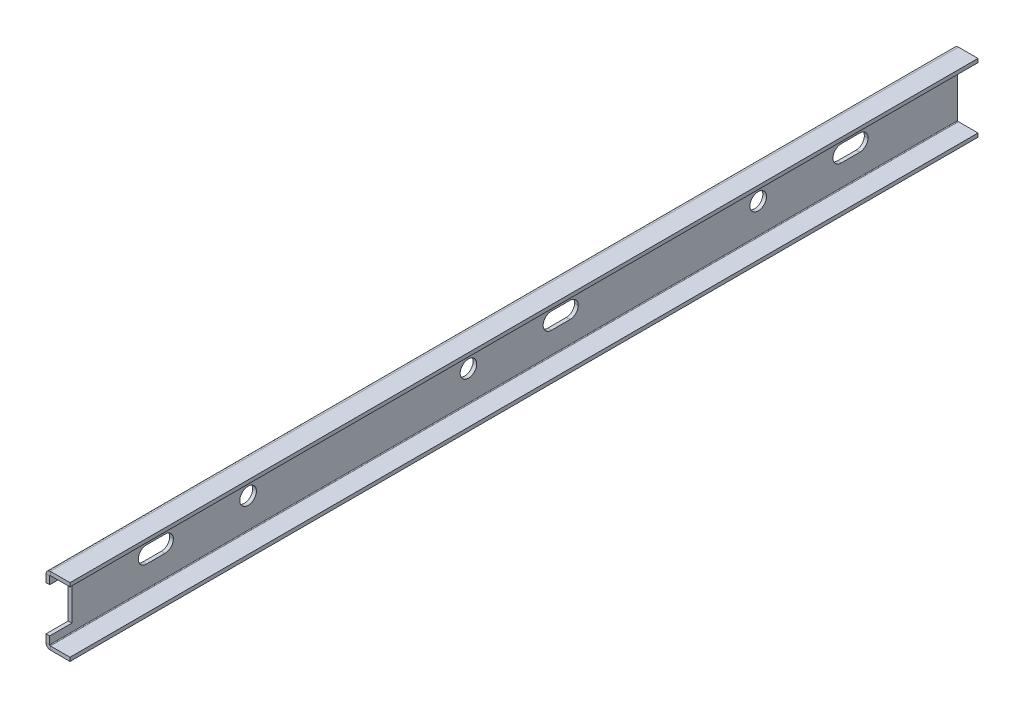
from build123d import *

# Parameters (mm, degrees)
SM_BASE_FLANGE_1_DEPTH         = 123
SKETCH_2_W                     = 6
SKETCH_2_H                     = 12
CUT_EXTRUDE_1_DEPTH            = 1
SKETCH_3_W                     = 9.5
SKETCH_3_H                     = 4.5
CUT_EXTRUDE_2_DEPTH            = 1
FILLET_1_R                     = 2.25
SKETCH_4_R                     = 2.25
CUT_EXTRUDE_3_DEPTH            = 1
PATTERN_LINEAR_1_COUNT         = 2
PATTERN_LINEAR_1_PITCH         = 109.7
FILLET_1_OF_PATTERN_LINEAR_1_R = 2.25
PATTERN_LINEAR_2_COUNT         = 2
PATTERN_LINEAR_2_PITCH         = 188.2
FILLET_1_OF_PATTERN_LINEAR_2_R = 2.25
PATTERN_LINEAR_3_COUNT         = 2
PATTERN_LINEAR_3_PITCH         = 59.7
PATTERN_LINEAR_4_COUNT         = 2
PATTERN_LINEAR_4_PITCH         = 138.2


# Sheet-metal steps are written as plain solids
with BuildPart() as part:
    # Sketch 1 → Базовая кромка1 (new, symmetric)
    with BuildSketch(Plane.XY):
        with BuildLine():
            Line((6.5, 9.25), (1.2, 9.25))
            ThreePointArc((1.2, 9.25), (0.351471863, 8.898528137), (0, 8.05))
            Line((0, 8.05), (0, -8.05))
            ThreePointArc((0, -8.05), (0.351471863, -8.898528137), (1.2, -9.25))
            Line((1.2, -9.25), (6.5, -9.25))
            Line((6.5, -9.25), (6.5, -8.25))
            Line((6.5, -8.25), (1.2, -8.25))
            ThreePointArc((1.2, -8.25), (1.058578644, -8.191421356), (1, -8.05))
            Line((1, -8.05), (1, 8.05))
            ThreePointArc((1, 8.05), (1.058578644, 8.191421356), (1.2, 8.25))
            Line((1.2, 8.25), (6.5, 8.25))
            Line((6.5, 8.25), (6.5, 9.25))
        make_face()
    extrude(amount=SM_BASE_FLANGE_1_DEPTH, both=True)

    # Эскиз2 → Вытянуть1 (cut)
    with BuildSketch(Plane.ZY):
        with Locations((120, 0)):
            Rectangle(SKETCH_2_W, SKETCH_2_H)
    extrude(amount=-CUT_EXTRUDE_1_DEPTH, mode=Mode.SUBTRACT)

    # Эскиз3 → Вытянуть2 (cut)
    with BuildSketch(Plane.ZY):
        with Locations((94.25, 0)):
            Rectangle(SKETCH_3_W, SKETCH_3_H)
    cut_extrude_2 = extrude(amount=-CUT_EXTRUDE_2_DEPTH, mode=Mode.SUBTRACT)

    # Скругление1
    fillet_1_edges = [part.edges().sort_by_distance(p)[0] for p in [
        (0.5, 2.25, 99),
        (0.5, -2.25, 99),
        (0.5, 2.25, 89.5),
        (0.5, -2.25, 89.5),
    ]]
    fillet(fillet_1_edges, radius=FILLET_1_R - 0.0001)  # a hair under: the kernel refuses the full size

    # Эскиз4 → Вытянуть3 (cut)
    with BuildSketch(Plane.ZY):
        with Locations(Location((69.25, 0, 0), (0, 0, 270))):
            Circle(SKETCH_4_R)
    cut_extrude_3 = extrude(amount=-CUT_EXTRUDE_3_DEPTH, mode=Mode.SUBTRACT)

    # Линейный массив1: Вытянуть2 ×2
    with Locations(*[(0, 0, -i * PATTERN_LINEAR_1_PITCH) for i in range(1, PATTERN_LINEAR_1_COUNT)]):
        add(cut_extrude_2, mode=Mode.SUBTRACT)

    # Скругление1 of Линейный массив1
    fillet_1_of_pattern_linear_1_edges = [part.edges().sort_by_distance(p)[0] for p in [
        (0.5, 2.25, -10.7),
        (0.5, -2.25, -10.7),
        (0.5, 2.25, -20.2),
        (0.5, -2.25, -20.2),
    ]]
    fillet(fillet_1_of_pattern_linear_1_edges, radius=FILLET_1_OF_PATTERN_LINEAR_1_R - 0.0001)  # a hair under: the kernel refuses the full size

    # Линейный массив2: Вытянуть2 ×2
    with Locations(*[(0, 0, -i * PATTERN_LINEAR_2_PITCH) for i in range(1, PATTERN_LINEAR_2_COUNT)]):
        add(cut_extrude_2, mode=Mode.SUBTRACT)

    # Скругление1 of Линейный массив2
    fillet_1_of_pattern_linear_2_edges = [part.edges().sort_by_distance(p)[0] for p in [
        (0.5, 2.25, -89.2),
        (0.5, -2.25, -89.2),
        (0.5, 2.25, -98.7),
        (0.5, -2.25, -98.7),
    ]]
    fillet(fillet_1_of_pattern_linear_2_edges, radius=FILLET_1_OF_PATTERN_LINEAR_2_R - 0.0001)  # a hair under: the kernel refuses the full size

    # Линейный массив3: Вытянуть3 ×2
    with Locations(*[(0, 0, -i * PATTERN_LINEAR_3_PITCH) for i in range(1, PATTERN_LINEAR_3_COUNT)]):
        add(cut_extrude_3, mode=Mode.SUBTRACT)

    # Линейный массив4: Вытянуть3 ×2
    with Locations(*[(0, 0, -i * PATTERN_LINEAR_4_PITCH) for i in range(1, PATTERN_LINEAR_4_COUNT)]):
        add(cut_extrude_3, mode=Mode.SUBTRACT)


solid = part.part
